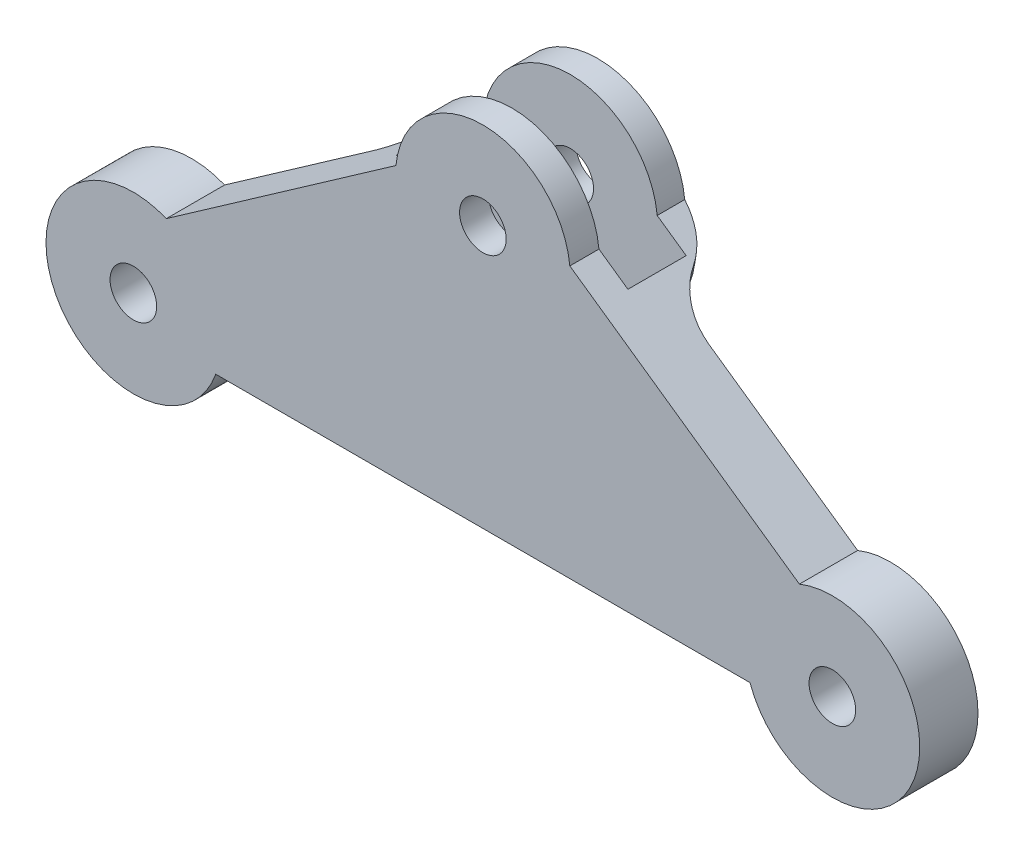
from build123d import *

# Parameters (mm, degrees)
SKETCH1_R               = 4
BOSS_EXTRUDE1_DEPTH     = 20
SKETCH2_R               = 4
CUT_EXTRUDE1_DEPTH      = 10
FILLET2_R               = 10
CUT_EXTRUDE2_DEPTH      = 5
CUT_EXTRUDE2_DEPTH_BACK = 5
SKETCH5_R               = 20
ECHELLE1_SCALE          = 0.6


with BuildPart() as part:
    # Sketch1 → Boss-Extrude1 (new body)
    with BuildSketch(Plane.XY):
        with BuildLine():
            Line((5.660747058, 13.890858244), (45.074020085, 41.488329122))
            ThreePointArc((45.074020085, 41.488329122), (60, 55), (74.925979915, 41.488329122))
            Line((74.925979915, 41.488329122), (114.339252942, 13.890858244))
            ThreePointArc((114.339252942, 13.890858244), (133.684102891, -6.143722656), (105.857864376, -5))
            Line((105.857864376, -5), (14.142135624, -5))
            ThreePointArc((14.142135624, -5), (-13.684102891, -6.143722656), (5.660747058, 13.890858244))
        make_face()
        with Locations((60, 40)):
            Circle(SKETCH1_R, mode=Mode.SUBTRACT)
        with Locations((120, 0)):
            Circle(SKETCH1_R, mode=Mode.SUBTRACT)
        Circle(SKETCH1_R, mode=Mode.SUBTRACT)
    extrude(amount=BOSS_EXTRUDE1_DEPTH)

    # Sketch2 → Cut-Extrude1 (cut)
    with BuildSketch(Plane(origin=(0, 0, 0), x_dir=(-1, 0, 0), z_dir=(0, 0, -1))):
        with BuildLine():
            ThreePointArc((-40.099720592, 38.00528712), (-60, 20), (-79.900279408, 38.00528712))
            Line((-79.900279408, 38.00528712), (-114.339252942, 13.890858244))
            ThreePointArc((-114.339252942, 13.890858244), (-133.684102891, -6.143722656), (-105.857864376, -5))
            Line((-105.857864376, -5), (-14.142135624, -5))
            ThreePointArc((-14.142135624, -5), (13.684102891, -6.143722656), (-5.660747058, 13.890858244))
            Line((-5.660747058, 13.890858244), (-40.099720592, 38.00528712))
        make_face()
        with Locations((-120, 0)):
            Circle(SKETCH2_R, mode=Mode.SUBTRACT)
        Circle(SKETCH2_R, mode=Mode.SUBTRACT)
    extrude(amount=-CUT_EXTRUDE1_DEPTH, mode=Mode.SUBTRACT)

    # Fillet2
    fillet2_edges = [part.edges().sort_by_distance(p)[0] for p in [
        (60, 20, 10),
    ]]
    fillet(fillet2_edges, radius=FILLET2_R - 0.0001)  # a hair under: the kernel refuses the full size

    # Fillet3: read off the stored shape, not the designer's step
    # Fillet3 outline → Fillet3 (revolve, cut)
    with BuildSketch(Plane(origin=(60, 40, 0), x_dir=(1, 0, 0), z_dir=(0, -1, 0))):
        with BuildLine():
            Line((21.33974599, 0), (21.33974599, 5.000000048))
            ThreePointArc((21.33974599, 5.000000048), (17.679491948, 1.339745976), (12.679491924, 0))
            Line((12.679491924, 0), (21.33974599, 0))
        make_face()
    revolve(axis=Axis((60, 40, 0), (0, 0, 1)), mode=Mode.SUBTRACT)

    # Sketch5 → Cut-Extrude2 (cut, two sides: drawn at the far end of the back side and taken through both)
    with BuildSketch(Plane.XY.offset(10).offset(-CUT_EXTRUDE2_DEPTH_BACK)):
        with Locations((60, 40)):
            Circle(SKETCH5_R)
    extrude(amount=CUT_EXTRUDE2_DEPTH + CUT_EXTRUDE2_DEPTH_BACK, mode=Mode.SUBTRACT)


with BuildPart() as part_1:
    # Echelle1: scaled about (60.000000152, 13.239920992, 14.069971935)
    add(part.part.scale(ECHELLE1_SCALE).moved(Location((24.000000061, 5.295968397, 5.627988774))))


solid = part_1.part
